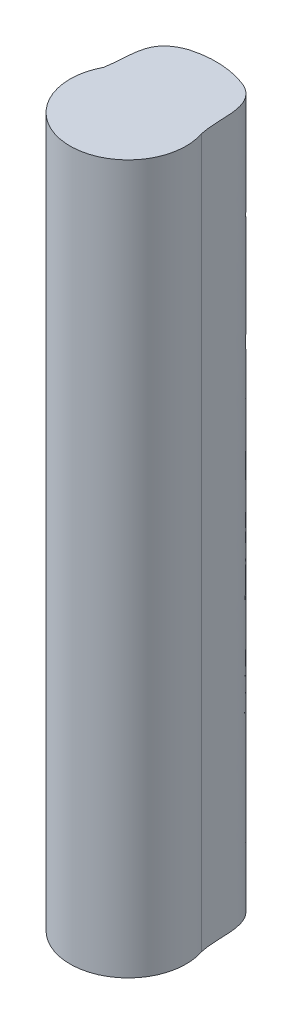
from build123d import *

# Parameters (mm, degrees)
SKETCH1_R           = 25.273
BOSS_EXTRUDE1_DEPTH = 203.2
CUT_EXTRUDE1_START  = -203.2
CUT_EXTRUDE1_DEPTH  = 203.2


with BuildPart() as part:
    # Sketch1 → Boss-Extrude1 (new body)
    with BuildSketch(Plane(origin=(0, 0, 0), x_dir=(1, 0, 0), z_dir=(0, 1, 0))):
        Circle(SKETCH1_R)
    extrude(amount=BOSS_EXTRUDE1_DEPTH)

    # Sketch2 → Cut-Extrude1 (cut)
    with BuildSketch(Plane(origin=(0, 203.2, 0), x_dir=(1, 0, 0), z_dir=(0, 1, 0)).offset(CUT_EXTRUDE1_START)):
        with BuildLine():
            ThreePointArc((16.131428812, 4.121833886), (16.519624093, 2.077144651), (16.6497, 0))
            ThreePointArc((16.6497, 0), (-2.077144651, -16.519624093), (-16.131428812, 4.121833886))
            ThreePointArc((-16.131428812, 4.121833886), (-15.535644224, 5.988010406), (-14.724792916, 7.771292277))
            add(Edge.make_bspline(
                [(-14.724792916, 7.771292277), (-13.993112244, 11.833627294), (-14.951269099, 19.976611229), (-9.134694512, 23.553200783), (-6.765592548, 24.350591091)],
                knots=[0.117816193, 0.117816193, 0.117816193, 0.117816193, 0.459844437, 0.648405496, 0.648405496, 0.648405496, 0.648405496], degree=3))
            ThreePointArc((-6.765592548, 24.350591091), (-15.292771308, -20.121025688), (25.273, 0))
            ThreePointArc((25.273, 0), (21.007635157, 14.050046053), (9.651285593, 23.357594384))
            add(Edge.make_bspline(
                [(15.783143796, 5.301403776), (14.234187932, 11.657324188), (17.010518971, 19.800729125), (9.651285593, 23.357594384)],
                knots=[0.052591674, 0.052591674, 0.052591674, 0.052591674, 0.886528555, 0.886528555, 0.886528555, 0.886528555], degree=3))
            ThreePointArc((15.783143796, 5.301403776), (15.968181877, 4.714835907), (16.131428812, 4.121833886))
        make_face()
    extrude(amount=CUT_EXTRUDE1_DEPTH, mode=Mode.SUBTRACT)


solid = part.part
